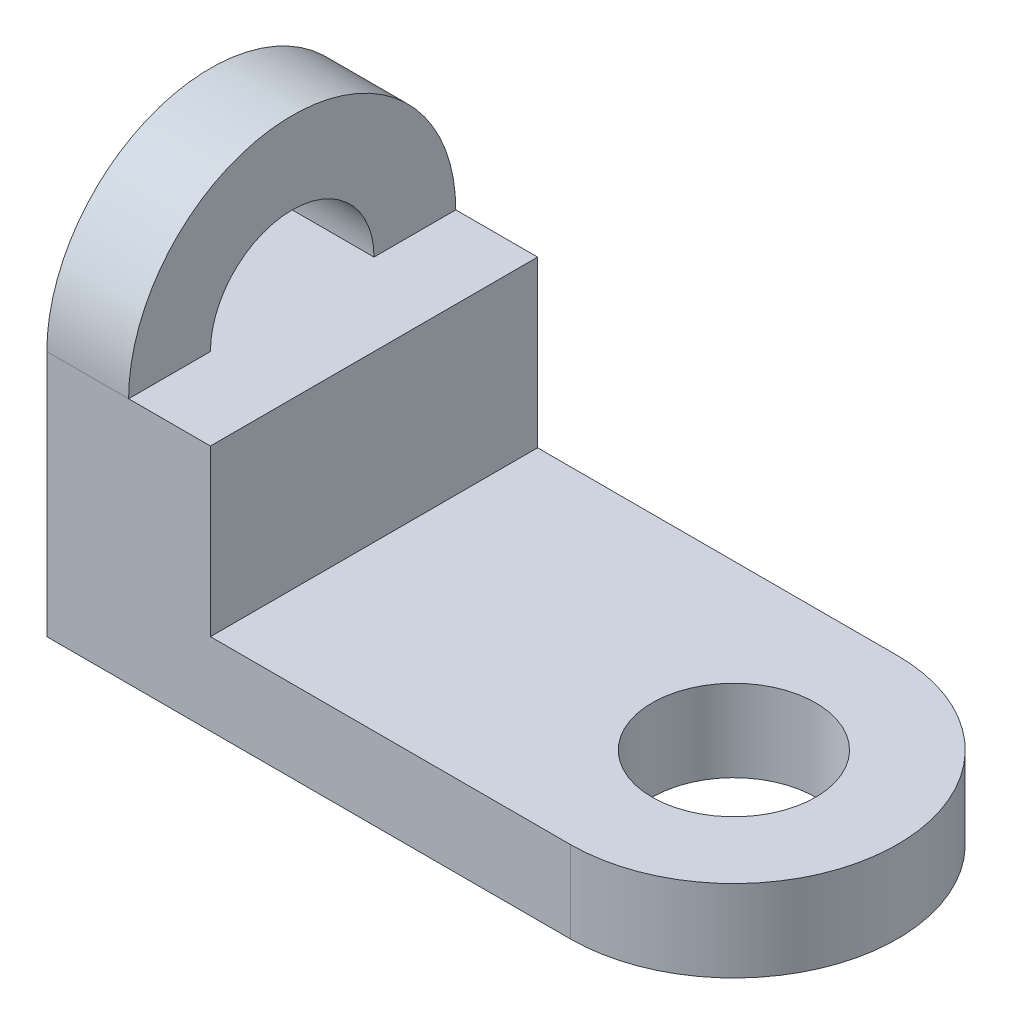
from build123d import *

# Parameters (mm, degrees)
SKETCH1_R           = 254
BOSS_EXTRUDE1_DEPTH = 254
SKETCH6_W           = 508
SKETCH6_H           = 1016
BOSS_EXTRUDE2_DEPTH = 512.826
SKETCH8_R           = 254
BOSS_EXTRUDE3_DEPTH = 254


with BuildPart() as part:
    # Sketch1 → Boss-Extrude1 (new body)
    with BuildSketch(Plane(origin=(0, 0, 0), x_dir=(1, 0, 0), z_dir=(0, 1, 0))):
        with BuildLine():
            Line((0, 508), (-1625.6, 508))
            Line((-1625.6, 508), (-1625.6, -508))
            Line((-1625.6, -508), (0, -508))
            ThreePointArc((0, -508), (508, 0), (0, 508))
        make_face()
        Circle(SKETCH1_R, mode=Mode.SUBTRACT)
    extrude(amount=BOSS_EXTRUDE1_DEPTH)

    # Sketch6 → Boss-Extrude2 (add)
    with BuildSketch(Plane(origin=(0, 254, 0), x_dir=(1, 0, 0), z_dir=(0, 1, 0))):
        with Locations((-1371.6, 0)):
            Rectangle(SKETCH6_W, SKETCH6_H)
    extrude(amount=BOSS_EXTRUDE2_DEPTH)

    # Sketch8 → Boss-Extrude3 (add)
    with BuildSketch(Plane(origin=(-1625.6, 0, 0), x_dir=(0, 0, -1), z_dir=(1, 0, 0))):
        with BuildLine():
            Line((508, 766.826), (508, 0))
            Line((508, 0), (-508, 0))
            Line((-508, 0), (-508, 766.826))
            ThreePointArc((-508, 766.826), (0, 1274.826), (508, 766.826))
        make_face()
        with Locations((0, 766.826)):
            Circle(SKETCH8_R, mode=Mode.SUBTRACT)
    extrude(amount=BOSS_EXTRUDE3_DEPTH)


solid = part.part
